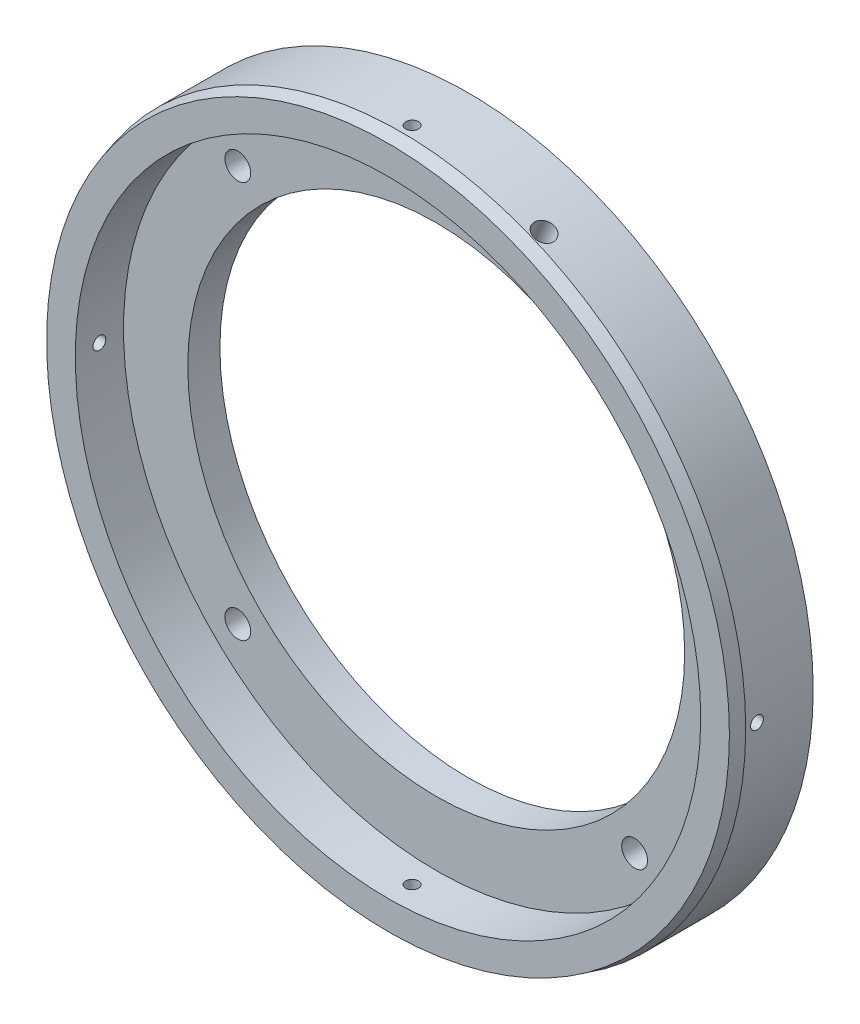
from build123d import *

# Parameters (mm, degrees)
SKETCH1_R                       = 68.1355
SKETCH1_R_2                     = 49.0855
EXTRUDE1_DEPTH                  = 15.875
SKETCH2_R                       = 61.7855
EXTRUDE2_DEPTH                  = 9.525
F_21_0_159_DIAMETER_HOLE1_D     = 4.0386
F_21_0_159_DIAMETER_HOLE1_DEPTH = 12.7
F_21_0_159_DIAMETER_HOLE1_TIP   = 1.213317848
CIRPATTERN1_COUNT               = 4
CIRPATTERN2_COUNT               = 4
CHAMFER1_SIZE                   = 2.54
CHAMFER1_SIZE2                  = 0.680590949


with BuildPart() as part:
    # Sketch1 → Extrude1 (new body)
    with BuildSketch(Plane.XY):
        Circle(SKETCH1_R)
        Circle(SKETCH1_R_2, mode=Mode.SUBTRACT)
    extrude(amount=EXTRUDE1_DEPTH)

    # Sketch2 → Extrude2 (cut)
    with BuildSketch(Plane.XY.offset(15.875)):
        Circle(SKETCH2_R)
    extrude(amount=-EXTRUDE2_DEPTH, mode=Mode.SUBTRACT)

    # #21 (0.159) Diameter Hole1
    with Locations(Plane(origin=(26.074327006, 62.948993887, 11.1125), x_dir=(-0.9238795325112864, 0.38268343236509067, 0), z_dir=(0.38268343236509067, 0.9238795325112864, 0))):
        with Locations((0, 0)):
            Hole(F_21_0_159_DIAMETER_HOLE1_D / 2, depth=F_21_0_159_DIAMETER_HOLE1_DEPTH)
            with Locations((0, 0, -(F_21_0_159_DIAMETER_HOLE1_DEPTH + F_21_0_159_DIAMETER_HOLE1_TIP / 2))):  # 118° drill point
                Cone(0, F_21_0_159_DIAMETER_HOLE1_D / 2, F_21_0_159_DIAMETER_HOLE1_TIP, mode=Mode.SUBTRACT)

    # Sketch4 → #39 (0.0995) Diameter Hole2 (revolve, cut)
    with BuildSketch(Plane(origin=(0, 68.1355, 11.1125), x_dir=(0, 0, 1), z_dir=(1, 0, 0))):
        Polygon((0, 0), (0, 13.459277521), (1.26365, 12.7), (1.26365, 0), align=None)
    f_39_0_0995_diameter_hole2 = revolve(axis=Axis((0, 74.4855, 11.1125), (0, -1, 0)), mode=Mode.SUBTRACT)

    # CirPattern1: #39 (0.0995) Diameter Hole2 ×4 about axis
    cirpattern1_axis = Axis((0, 0, 15.875), (0, 0, -1))
    for i in range(1, CIRPATTERN1_COUNT):
        add(f_39_0_0995_diameter_hole2.rotate(cirpattern1_axis, i * 360 / CIRPATTERN1_COUNT), mode=Mode.SUBTRACT)

    # Sketch8 → #7 (0.201) Diameter Hole1 (revolve, cut)
    with BuildSketch(Plane(origin=(39.198817968, 39.198817968, 11.1125), x_dir=(0, -1, 0), z_dir=(1, 0, 0))):
        Polygon((0, 0), (0, 14.233816902), (2.5527, 12.7), (2.5527, 0), align=None)
    f_7_0_201_diameter_hole1 = revolve(axis=Axis((39.198817968, 39.198817968, 17.4625), (0, 0, -1)), mode=Mode.SUBTRACT)

    # CirPattern2: #7 (0.201) Diameter Hole1 ×4 about axis
    cirpattern2_axis = Axis((0, 0, 15.875), (0, 0, -1))
    for i in range(1, CIRPATTERN2_COUNT):
        add(f_7_0_201_diameter_hole1.rotate(cirpattern2_axis, i * 360 / CIRPATTERN2_COUNT), mode=Mode.SUBTRACT)

    # Chamfer1
    chamfer1_edges = [part.edges().sort_by_distance(p)[0] for p in [
        (-68.1355, 0, 15.875),
    ]]
    chamfer1_side = [part.faces().sort_by_distance(p)[0] for p in [
        (-68.1355, 0, 7.9375),
    ]]
    chamfer(chamfer1_edges, length=CHAMFER1_SIZE, length2=CHAMFER1_SIZE2, reference=chamfer1_side[0])


solid = part.part
